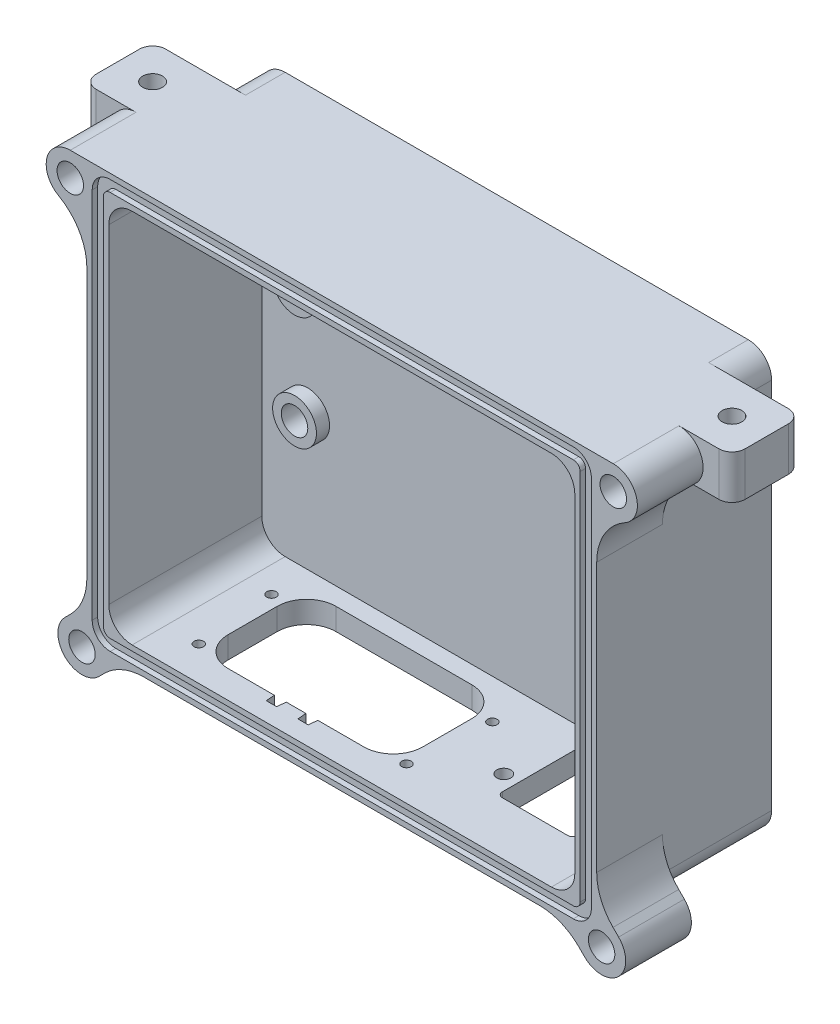
from build123d import *

# Parameters (mm, degrees)
SKETCH1_W             = 106.3625
SKETCH1_H             = 85.725
BOSS_EXTRUDE1_DEPTH   = 34.925
SHELL1_T              = 5
FILLET1_R             = 5.334
CUT_EXTRUDE1_DEPTH    = 1.2446
BOSS_EXTRUDE2_DEPTH   = 15
BOSS_EXTRUDE2_2_DEPTH = 15
SKETCH5_R             = 3.025
CUT_EXTRUDE4_DEPTH    = 8
FILLET2_R             = 12.7
BOSS_EXTRUDE4_DEPTH   = 10
BOSS_EXTRUDE5_REACH   = 133.061
SKETCH9_W             = 5.334
SKETCH9_H             = 15.875
FILLET3_R             = 3
BOSS_EXTRUDE6_REACH   = 133.061
SKETCH12_W            = 5.334
SKETCH12_H            = 15.875
M4_CLEARANCE_HOLE1_D  = 4.5
SKETCH13_R            = 1.6
CUT_EXTRUDE6_DEPTH    = 5
SKETCH15_R            = 5
SKETCH15_R_2          = 3.025
BOSS_EXTRUDE7_DEPTH   = 3
CUT_EXTRUDE7_START    = -2.5
SKETCH16_R            = 3.025
CUT_EXTRUDE7_DEPTH    = 2.5


with BuildPart() as part:
    # Sketch1 → Boss-Extrude1 (new body)
    with BuildSketch(Plane.XY):
        Rectangle(SKETCH1_W, SKETCH1_H)
    extrude(amount=BOSS_EXTRUDE1_DEPTH)

    # Shell1
    shell1_openings = [part.faces().sort_by_distance(p)[0] for p in [
        (0, 0, 34.925),
    ]]
    offset(amount=SHELL1_T, openings=shell1_openings, kind=Kind.INTERSECTION)

    # Fillet1
    # the kernel refuses this fillet: 5.334 mm, written as the material it adds along each edge
    with BuildSketch(Plane(origin=(53.18125, -42.8625, 0), x_dir=(0, 1, 0), z_dir=(0, 0, 1)), Plane(origin=(53.18125, 42.8625, 0), x_dir=(-1, 0, 0), z_dir=(0, 0, 1)), Plane(origin=(-53.18125, -42.8625, 0), x_dir=(1, 0, 0), z_dir=(0, 0, 1))) as fillet1_piece_1:
        with BuildLine():
            CenterArc((FILLET1_R, FILLET1_R), FILLET1_R, 180, 90)
            Line((0, FILLET1_R), (0, 0))
            Line((0, 0), (FILLET1_R, 0))
        make_face()
    extrude(amount=34.925)
    with BuildSketch(Plane(origin=(-53.18125, 42.8625, 0), x_dir=(1, 0, 0), z_dir=(0, 0, 1))) as fillet1_piece_2:
        with BuildLine():
            CenterArc((FILLET1_R, -FILLET1_R), FILLET1_R, 90, 90)
            Line((0, -FILLET1_R), (0, 0))
            Line((0, 0), (FILLET1_R, 0))
        make_face()
    extrude(amount=34.925)
    # the kernel refuses this fillet: 5.334 mm, written as the material it takes off along each edge
    with BuildSketch(Plane(origin=(58.18125, -47.8625, 48.26), x_dir=(-1, 0, 0), z_dir=(0, 0, -1)), Plane(origin=(-58.18125, 47.8625, -18.335), x_dir=(0, -1, 0), z_dir=(0, 0, 1))) as fillet1_2_piece_1:
        with BuildLine():
            CenterArc((FILLET1_R, FILLET1_R), FILLET1_R, 180, 90)
            Line((0, FILLET1_R), (0, 0))
            Line((0, 0), (FILLET1_R, 0))
        make_face()
    extrude(amount=66.595, mode=Mode.SUBTRACT)
    with BuildSketch(Plane(origin=(-58.18125, -47.8625, 48.26), x_dir=(1, 0, 0), z_dir=(0, 0, -1)), Plane(origin=(58.18125, 47.8625, 48.26), x_dir=(-1, 0, 0), z_dir=(0, 0, -1))) as fillet1_2_piece_2:
        with BuildLine():
            CenterArc((FILLET1_R, -FILLET1_R), FILLET1_R, 90, 90)
            Line((0, -FILLET1_R), (0, 0))
            Line((0, 0), (FILLET1_R, 0))
        make_face()
    extrude(amount=66.595, mode=Mode.SUBTRACT)

    # Sketch2 → Cut-Extrude1 (cut)
    with BuildSketch(Plane.XY.offset(34.925)):
        with BuildLine():
            Line((-52.84725, -46.6452), (52.84725, -46.6452))
            ThreePointArc((52.84725, -46.6452), (55.758196486, -45.439446486), (56.96395, -42.5285))
            Line((56.96395, -42.5285), (56.96395, 42.5285))
            ThreePointArc((56.96395, 42.5285), (55.758196486, 45.439446486), (52.84725, 46.6452))
            Line((52.84725, 46.6452), (-52.84725, 46.6452))
            ThreePointArc((-52.84725, 46.6452), (-55.758196486, 45.439446486), (-56.96395, 42.5285))
            Line((-56.96395, 42.5285), (-56.96395, -42.5285))
            ThreePointArc((-56.96395, -42.5285), (-55.758196486, -45.439446486), (-52.84725, -46.6452))
        make_face()
        with BuildLine():
            Line((-54.39855, 42.5285), (-54.39855, -42.5285))
            ThreePointArc((-54.39855, -42.5285), (-53.94418475, -43.62543475), (-52.84725, -44.0798))
            Line((-52.84725, -44.0798), (52.84725, -44.0798))
            ThreePointArc((52.84725, -44.0798), (53.94418475, -43.62543475), (54.39855, -42.5285))
            Line((54.39855, -42.5285), (54.39855, 42.5285))
            ThreePointArc((54.39855, 42.5285), (53.94418475, 43.62543475), (52.84725, 44.0798))
            Line((52.84725, 44.0798), (-52.84725, 44.0798))
            ThreePointArc((-52.84725, 44.0798), (-53.94418475, 43.62543475), (-54.39855, 42.5285))
        make_face(mode=Mode.SUBTRACT)
    extrude(amount=-CUT_EXTRUDE1_DEPTH, mode=Mode.SUBTRACT)


with BuildPart() as body_2:
    # Sketch4 → Boss-Extrude2 (new body)
    with BuildSketch(Plane.XY.offset(34.925)):
        with BuildLine():
            ThreePointArc((52.84725, 47.8625), (56.618957571, 46.300207571), (58.18125, 42.5285))
            Line((58.18125, 42.5285), (58.18125, 36.8625))
            Line((58.18125, 36.8625), (61.96395, 36.8625))
            ThreePointArc((61.96395, 36.8625), (67.46395, 42.3625), (61.96395, 47.8625))
            Line((61.96395, 47.8625), (52.84725, 47.8625))
        make_face()
    extrude(amount=-BOSS_EXTRUDE2_DEPTH)


with BuildPart() as body_3:
    # Sketch4 → Boss-Extrude2 2 (new body)
    with BuildSketch(Plane.XY.offset(34.925)):
        with BuildLine():
            Line((63.182817689, -45.085893096), (58.18125, -40.084325407))
            Line((58.18125, -40.084325407), (58.18125, -42.5285))
            ThreePointArc((58.18125, -42.5285), (57.775223426, -44.569733428), (56.618957571, -46.300207571))
            ThreePointArc((56.618957571, -46.300207571), (54.888483428, -47.456473426), (52.84725, -47.8625))
            Line((52.84725, -47.8625), (50.403075407, -47.8625))
            Line((50.403075407, -47.8625), (55.404643096, -52.864067689))
            ThreePointArc((55.404643096, -52.864067689), (63.182817689, -52.864067689), (63.182817689, -45.085893096))
        make_face()
    extrude(amount=-BOSS_EXTRUDE2_2_DEPTH)


with BuildPart() as cut_extrude4_tool:
    # Sketch5 → Cut-Extrude4 (new body)
    with BuildSketch(Plane.XY.offset(34.925)):
        with Locations((59.293730392, -48.974980392)):
            Circle(SKETCH5_R)
        with Locations((61.96395, 42.3625)):
            Circle(SKETCH5_R)
    extrude(amount=-CUT_EXTRUDE4_DEPTH)


with BuildPart() as body_2_1:
    add(body_2.part)

    # Cut-Extrude4: cut by cut_extrude4_tool
    add(cut_extrude4_tool.part, mode=Mode.SUBTRACT)


with BuildPart() as body_3_1:
    add(body_3.part)

    # Cut-Extrude4: cut by cut_extrude4_tool
    add(cut_extrude4_tool.part, mode=Mode.SUBTRACT)


with BuildPart() as body_4:
    # Mirror3: mirrored copy
    add(body_3_1.part.mirror(Plane(origin=(0, 0, 0), x_dir=(0, 0, 1), z_dir=(1, 0, 0))))


with BuildPart() as body_5:
    # Mirror3 2: mirrored copy
    add(body_2_1.part.mirror(Plane(origin=(0, 0, 0), x_dir=(0, 0, 1), z_dir=(1, 0, 0))))


with BuildPart() as part_1:
    add(part.part)

    # Combine3: union body 3, body 2, body 4, body 5
    add(body_3_1.part)
    add(body_2_1.part)
    add(body_4.part)
    add(body_5.part)

    # Fillet2
    # the kernel refuses this fillet: 12.7 mm, written as the material it adds along each edge
    with BuildSketch(Plane(origin=(-58.18125, 36.8625, 34.925), x_dir=(-0.994122467087749, 0.10826135243644212, 0), z_dir=(0, 0, -1))) as fillet2_piece_1_section:
        with BuildLine():
            CenterArc((11.503146113, -11.67973592), FILLET2_R, 113.1229538, 60.661946359)
            Line((-1.122209219, -10.304816744), (-2.384744752, -10.167324826))
            Line((-2.384744752, -10.167324826), (-1.262535533, 0.137491918))
            Line((-1.262535533, 0.137491918), (0.137491918, 1.262535533))
            ThreePointArc((0.137491918, 1.262535533), (3.897958974, 0.853015315), (6.017049113, 1.167973592))
            Line((6.017049113, 1.167973592), (6.515785204, 0))
        make_face()
    fillet2_piece_1 = extrude(amount=15, mode=Mode.PRIVATE)
    fillet2_piece_1 = split(fillet2_piece_1, bisect_by=Plane(origin=(-56.96395, 32.923012579, 34.3027), z_dir=(-1, 0, 0)), keep=Keep.TOP, mode=Mode.PRIVATE)
    add(fillet2_piece_1)
    with BuildSketch(Plane(origin=(-50.403075407, -47.8625, 34.925), x_dir=(-0.7071067811865455, -0.7071067811865495, 0), z_dir=(0, 0, -1)), Plane(origin=(-58.18125, -40.084325407, 34.925), x_dir=(0, 1, 0), z_dir=(0, 0, -1)), Plane(origin=(58.18125, -40.084325407, 34.925), x_dir=(0.7071067811865482, -0.7071067811865468, 0), z_dir=(0, 0, -1))) as fillet2_piece_2:
        with BuildLine():
            CenterArc((FILLET2_R * 0.414213562373, -FILLET2_R), FILLET2_R, 90, 45)
            Line((-FILLET2_R * 0.292893218813, -FILLET2_R * 0.292893218813), (0, 0))
            Line((0, 0), (FILLET2_R * 0.414213562373, 0))
        make_face()
    extrude(amount=15)
    with BuildSketch(Plane(origin=(50.403075407, -47.8625, 34.925), x_dir=(0.7071067811865455, -0.7071067811865495, 0), z_dir=(0, 0, -1))) as fillet2_piece_3:
        with BuildLine():
            CenterArc((FILLET2_R * 0.414213562373, FILLET2_R), FILLET2_R, 225, 45)
            Line((-FILLET2_R * 0.292893218813, FILLET2_R * 0.292893218813), (0, 0))
            Line((0, 0), (FILLET2_R * 0.414213562373, 0))
        make_face()
    extrude(amount=15)
    with BuildSketch(Plane(origin=(58.18125, 36.8625, 34.925), x_dir=(0, -1, 0), z_dir=(0, 0, -1))) as fillet2_piece_4_section:
        with BuildLine():
            CenterArc((10.365741732, -12.7), FILLET2_R, 90, 60.661946359)
            Line((-0.705407718, -6.477488462), (-1.812522663, -5.855237308))
            ThreePointArc((-1.812522663, -5.855237308), (-1.27, -3.7827), (-1.27, 0))
            Line((-1.27, 0), (0, 1.27))
            Line((0, 1.27), (10.365741732, 1.27))
            Line((10.365741732, 1.27), (10.365741732, 0))
        make_face()
    fillet2_piece_4 = extrude(amount=15, mode=Mode.PRIVATE)
    fillet2_piece_4 = split(fillet2_piece_4, bisect_by=Plane(origin=(56.96395, 32.923012579, 34.3027), z_dir=(1, 0, 0)), keep=Keep.TOP, mode=Mode.PRIVATE)
    add(fillet2_piece_4)

    # Sketch8 → Boss-Extrude4 (add)
    with BuildSketch(Plane(origin=(0, 47.8625, 0), x_dir=(1, 0, 0), z_dir=(0, 1, 0))):
        with BuildLine():
            Line((-58.18125, -19.925), (-58.18125, -4.05))
            Line((-58.18125, -4.05), (-64.704536438, -10.573286438))
            ThreePointArc((-64.704536438, -10.573286438), (-64.270990935, -11.222133135), (-64.11875, -11.9875))
            ThreePointArc((-64.11875, -11.9875), (-65.353383135, -13.835259065), (-67.532963562, -13.401713562))
            Line((-67.532963562, -13.401713562), (-74.05625, -19.925))
            Line((-74.05625, -19.925), (-58.18125, -19.925))
        make_face()
        with BuildLine():
            Line((-64.704536438, -10.573286438), (-58.18125, -4.05))
            Line((-58.18125, -4.05), (-74.05625, -4.05))
            Line((-74.05625, -4.05), (-74.05625, -19.925))
            Line((-74.05625, -19.925), (-67.532963562, -13.401713562))
            ThreePointArc((-67.532963562, -13.401713562), (-67.532963562, -10.573286438), (-64.704536438, -10.573286438))
        make_face()
        with BuildLine():
            ThreePointArc((-64.11875, -11.9875), (-64.270990935, -11.222133135), (-64.704536438, -10.573286438))
            Line((-64.704536438, -10.573286438), (-67.532963562, -13.401713562))
            ThreePointArc((-67.532963562, -13.401713562), (-65.353383135, -13.835259065), (-64.11875, -11.9875))
        make_face()
        with BuildLine():
            Line((-67.532963562, -13.401713562), (-64.704536438, -10.573286438))
            ThreePointArc((-64.704536438, -10.573286438), (-67.532963562, -10.573286438), (-67.532963562, -13.401713562))
        make_face()
        with BuildLine():
            Line((74.05625, -4.05), (58.18125, -4.05))
            Line((58.18125, -4.05), (58.18125, -19.925))
            Line((58.18125, -19.925), (64.704536438, -13.401713562))
            ThreePointArc((64.704536438, -13.401713562), (64.704536438, -10.573286438), (67.532963562, -10.573286438))
            Line((67.532963562, -10.573286438), (74.05625, -4.05))
        make_face()
        with BuildLine():
            ThreePointArc((67.532963562, -10.573286438), (64.704536438, -10.573286438), (64.704536438, -13.401713562))
            Line((64.704536438, -13.401713562), (67.532963562, -10.573286438))
        make_face()
        with BuildLine():
            Line((67.532963562, -10.573286438), (64.704536438, -13.401713562))
            ThreePointArc((64.704536438, -13.401713562), (66.884116865, -13.835259065), (68.11875, -11.9875))
            ThreePointArc((68.11875, -11.9875), (67.966509065, -11.222133135), (67.532963562, -10.573286438))
        make_face()
        with BuildLine():
            Line((64.704536438, -13.401713562), (58.18125, -19.925))
            Line((58.18125, -19.925), (61.96395, -19.925))
            Line((61.96395, -19.925), (74.05625, -19.925))
            Line((74.05625, -19.925), (74.05625, -4.05))
            Line((74.05625, -4.05), (67.532963562, -10.573286438))
            ThreePointArc((67.532963562, -10.573286438), (67.966509065, -11.222133135), (68.11875, -11.9875))
            ThreePointArc((68.11875, -11.9875), (66.884116865, -13.835259065), (64.704536438, -13.401713562))
        make_face()
    extrude(amount=-BOSS_EXTRUDE4_DEPTH)

    # Sketch9 → Boss-Extrude5 (add, up to next)
    with BuildSketch(Plane(origin=(0, 47.8625, 0), x_dir=(1, 0, 0), z_dir=(0, 1, 0)), mode=Mode.PRIVATE) as boss_extrude5_sk1:
        with Locations((-55.51425, -11.9875)):
            Rectangle(SKETCH9_W, SKETCH9_H)
    boss_extrude5_tool1 = extrude(boss_extrude5_sk1.sketch, amount=-BOSS_EXTRUDE5_REACH, mode=Mode.PRIVATE) - part_1.part
    add(boss_extrude5_tool1.solids().sort_by_distance((-55.51425, 47.8625, 11.9875))[0])

    # Fillet3
    fillet3_edges = [part_1.edges().sort_by_distance(p)[0] for p in [
        (-74.05625, 42.8625, 19.925),
        (-74.05625, 42.8625, 4.05),
        (74.05625, 42.8625, 4.05),
        (74.05625, 42.8625, 19.925),
    ]]
    fillet(fillet3_edges, radius=FILLET3_R)

    # Sketch12 → Boss-Extrude6 (add, up to next)
    with BuildSketch(Plane(origin=(0, 47.8625, 0), x_dir=(1, 0, 0), z_dir=(0, 1, 0)), mode=Mode.PRIVATE) as boss_extrude6_sk1:
        with Locations((55.51425, -11.9875)):
            Rectangle(SKETCH12_W, SKETCH12_H)
    boss_extrude6_tool1 = extrude(boss_extrude6_sk1.sketch, amount=-BOSS_EXTRUDE6_REACH, mode=Mode.PRIVATE) - part_1.part
    add(boss_extrude6_tool1.solids().sort_by_distance((55.51425, 47.8625, 11.9875))[0])

    # M4 Clearance Hole1 (through all)
    with Locations(Plane(origin=(0, 37.8625, 0), x_dir=(-1, 0, 0), z_dir=(0, -1, 0))):
        with Locations((66.11875, -11.9875), (-66.11875, -11.9875)):
            Hole(M4_CLEARANCE_HOLE1_D / 2)

    # Sketch13 → Cut-Extrude6 (cut)
    with BuildSketch(Plane.XZ.offset(47.8625)):
        with BuildLine():
            Line((5.469338815, 21.930218955), (5.469338815, 10.730218955))
            ThreePointArc((5.469338815, 10.730218955), (3.506954249, 5.992603521), (-1.230661185, 4.030218955))
            Line((-1.230661185, 4.030218955), (-32.230661185, 4.030218955))
            ThreePointArc((-32.230661185, 4.030218955), (-36.968276619, 5.992603521), (-38.930661185, 10.730218955))
            Line((-38.930661185, 10.730218955), (-38.930661185, 21.930218955))
            ThreePointArc((-38.930661185, 21.930218955), (-36.968276619, 26.667834389), (-32.230661185, 28.630218955))
            Line((-32.230661185, 28.630218955), (-21.688826772, 28.630218955))
            Line((-21.688826772, 28.630218955), (-21.513849445, 30.630218955))
            Line((-21.513849445, 30.630218955), (-19.147472925, 30.630218955))
            Line((-19.147472925, 30.630218955), (-18.972495598, 28.630218955))
            Line((-18.972495598, 28.630218955), (-14.488826772, 28.630218955))
            Line((-14.488826772, 28.630218955), (-14.313849445, 30.630218955))
            Line((-14.313849445, 30.630218955), (-11.947472925, 30.630218955))
            Line((-11.947472925, 30.630218955), (-11.772495598, 28.630218955))
            Line((-11.772495598, 28.630218955), (-1.230661185, 28.630218955))
            ThreePointArc((-1.230661185, 28.630218955), (3.506954249, 26.667834389), (5.469338815, 21.930218955))
        make_face()
        with BuildLine():
            Line((40.68125, 21.725), (40.68125, 5.275))
            ThreePointArc((40.68125, 5.275), (40.344422798, 4.461827202), (39.53125, 4.125))
            Line((39.53125, 4.125), (24.58125, 4.125))
            ThreePointArc((24.58125, 4.125), (23.768077202, 4.461827202), (23.43125, 5.275))
            Line((23.43125, 5.275), (23.43125, 21.725))
            ThreePointArc((23.43125, 21.725), (23.768077202, 22.538172798), (24.58125, 22.875))
            Line((24.58125, 22.875), (39.53125, 22.875))
            ThreePointArc((39.53125, 22.875), (40.344422798, 22.538172798), (40.68125, 21.725))
        make_face()
        with BuildLine():
            ThreePointArc((-39.345661185, 27.130218955), (-40.430661185, 28.215218955), (-41.515661185, 27.130218955))
            ThreePointArc((-41.515661185, 27.130218955), (-40.430661185, 26.045218955), (-39.345661185, 27.130218955))
        make_face()
        with BuildLine():
            ThreePointArc((-40.845661185, 9.030218955), (-41.930661185, 10.115218955), (-43.015661185, 9.030218955))
            ThreePointArc((-43.015661185, 9.030218955), (-41.930661185, 7.945218955), (-40.845661185, 9.030218955))
        make_face()
        with BuildLine():
            ThreePointArc((9.554338815, 9.030218955), (8.469338815, 10.115218955), (7.384338815, 9.030218955))
            ThreePointArc((7.384338815, 9.030218955), (8.469338815, 7.945218955), (9.554338815, 9.030218955))
        make_face()
        with BuildLine():
            ThreePointArc((8.054338815, 27.130218955), (6.969338815, 28.215218955), (5.884338815, 27.130218955))
            ThreePointArc((5.884338815, 27.130218955), (6.969338815, 26.045218955), (8.054338815, 27.130218955))
        make_face()
        with Locations(Location((20.05625, 18, 0), (0, 0, 270))):
            Circle(SKETCH13_R)
        with Locations(Location((44.05625, 9, 0), (0, 0, 270))):
            Circle(SKETCH13_R)
    extrude(amount=-CUT_EXTRUDE6_DEPTH, mode=Mode.SUBTRACT)

    # Sketch15 → Boss-Extrude7 (add)
    # profile 1 of 4: a face of its own
    with BuildSketch(Plane.XY):
        with Locations((-42.71074387, -11.937295785)):
            Circle(SKETCH15_R)
        with Locations((-42.71074387, -11.937295785)):
            Circle(SKETCH15_R_2, mode=Mode.SUBTRACT)
    # profile 2 of 4: a face of its own
    with BuildSketch(Plane.XY):
        with Locations((-42.710743561, 13.970704215)):
            Circle(SKETCH15_R)
        with Locations((-42.710743561, 13.970704215)):
            Circle(SKETCH15_R_2, mode=Mode.SUBTRACT)
    # profile 3 of 4: a face of its own
    with BuildSketch(Plane.XY):
        with Locations((29.025256449, 14.878703359)):
            Circle(SKETCH15_R)
        with Locations((29.025256449, 14.878703359)):
            Circle(SKETCH15_R_2, mode=Mode.SUBTRACT)
    # profile 4 of 4: a face of its own
    with BuildSketch(Plane.XY):
        with Locations((29.025256116, -13.061296641)):
            Circle(SKETCH15_R)
        with Locations((29.025256116, -13.061296641)):
            Circle(SKETCH15_R_2, mode=Mode.SUBTRACT)
    extrude(amount=BOSS_EXTRUDE7_DEPTH)

    # Sketch16 → Cut-Extrude7 (cut)
    with BuildSketch(Plane.XY.offset(CUT_EXTRUDE7_START)):
        with Locations((29.025256116, -13.061296641)):
            Circle(SKETCH16_R)
        with Locations((29.025256449, 14.878703359)):
            Circle(SKETCH16_R)
        with Locations((-42.710743561, 13.970704215)):
            Circle(SKETCH16_R)
        with Locations((-42.71074387, -11.937295785)):
            Circle(SKETCH16_R)
    extrude(amount=CUT_EXTRUDE7_DEPTH, mode=Mode.SUBTRACT)


solid = part_1.part
